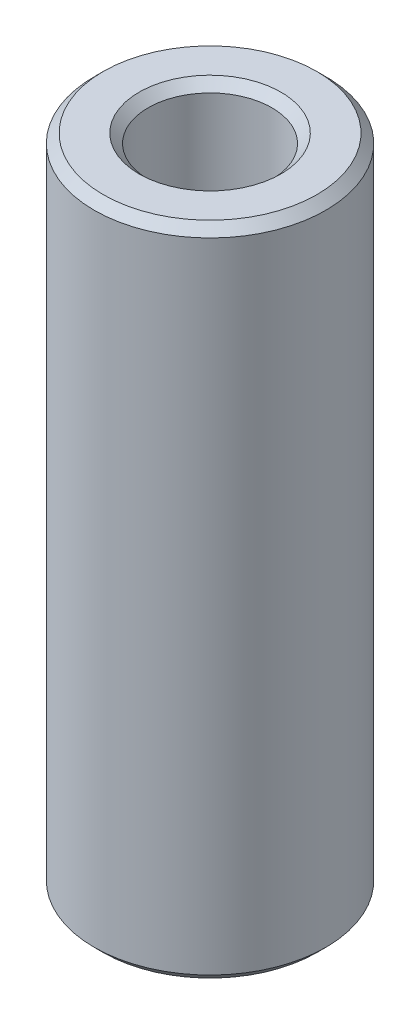
from build123d import *

# Parameters (mm, degrees)
SKETCH1_R           = 37.5
BOSS_EXTRUDE1_DEPTH = 212.584975608
SKETCH2_R           = 20.051062218
CUT_EXTRUDE1_DEPTH  = 220.100141155
CHAMFER1_SIZE       = 2.918581508


with BuildPart() as part:
    # Sketch1 → Boss-Extrude1 (new body)
    with BuildSketch(Plane(origin=(0, 0, 0), x_dir=(1, 0, 0), z_dir=(0, 1, 0))):
        Circle(SKETCH1_R)
    extrude(amount=BOSS_EXTRUDE1_DEPTH)

    # Sketch2 → Cut-Extrude1 (cut, through all)
    with BuildSketch(Plane(origin=(0, 0, 0), x_dir=(1, 0, 0), z_dir=(0, 1, 0))):
        Circle(SKETCH2_R)
    extrude(amount=CUT_EXTRUDE1_DEPTH, mode=Mode.SUBTRACT)

    # Chamfer1
    chamfer1_edges = [part.edges().sort_by_distance(p)[0] for p in [
        (-20.051062218, 212.584975608, 0),
        (-20.051062218, 0, 0),
        (-37.5, 0, 0),
        (-37.5, 212.584975608, 0),
    ]]
    chamfer(chamfer1_edges, length=CHAMFER1_SIZE)


solid = part.part
